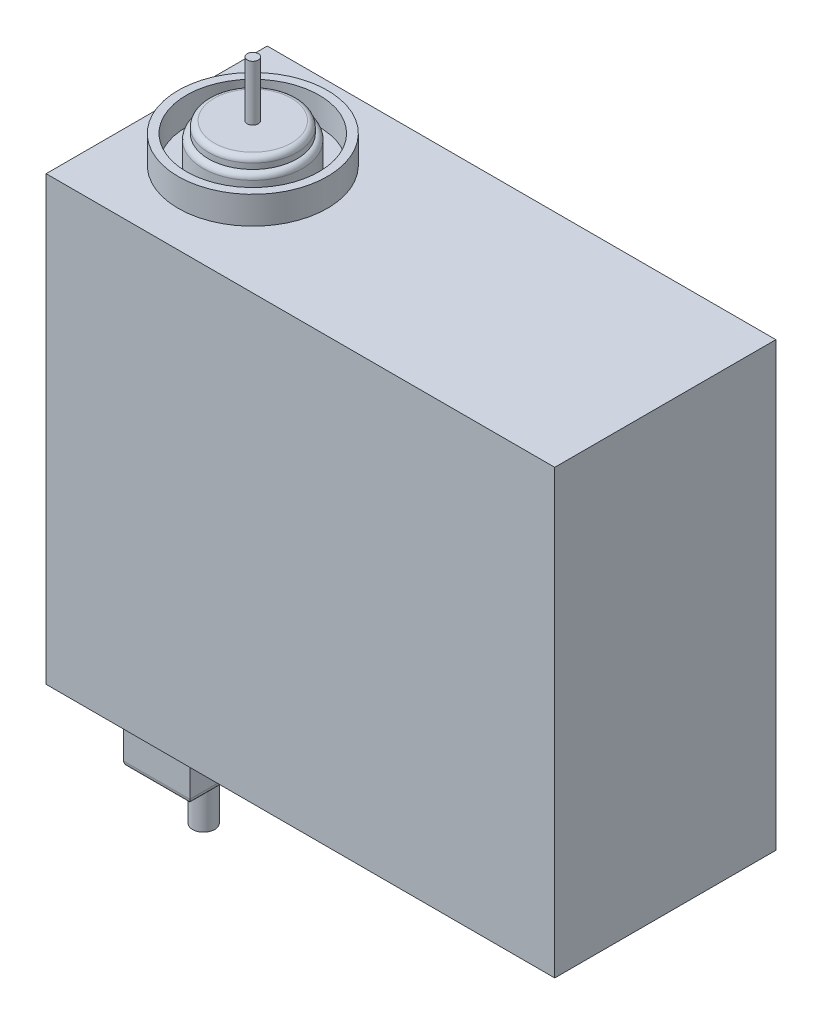
from build123d import *

# Parameters (mm, degrees)
SKETCH1_W           = 46
SKETCH1_H           = 20
BOSS_EXTRUDE1_DEPTH = 40
BOSS_EXTRUDE2_DEPTH = 2.5
SKETCH3_R           = 4
BOSS_EXTRUDE3_DEPTH = 1
FILLET3_R           = 0.5
FILLET4_R           = 0.5
SKETCH5_R           = 0.5
BOSS_EXTRUDE4_DEPTH = 5
SKETCH6_W           = 6
SKETCH6_H           = 16
BOSS_EXTRUDE5_DEPTH = 5
FILLET5_R           = 0.5
SKETCH7_R           = 1
BOSS_EXTRUDE6_DEPTH = 5


with BuildPart() as part:
    # Sketch1 → Boss-Extrude1 (new body)
    with BuildSketch(Plane(origin=(0, 0, 0), x_dir=(1, 0, 0), z_dir=(0, 1, 0))):
        with Locations((-31.181375009, 16.970817206)):
            Rectangle(SKETCH1_W, SKETCH1_H)
    extrude(amount=BOSS_EXTRUDE1_DEPTH)

    # Sketch2 → Boss-Extrude2 (add)
    with BuildSketch(Plane(origin=(0, 40, 0), x_dir=(1, 0, 0), z_dir=(0, 1, 0))):
        with BuildLine():
            ThreePointArc((-49.989558352, 16.970817206), (-45.489558352, 12.470817206), (-40.989558352, 16.970817206))
            Line((-40.989558352, 16.970817206), (-49.989558352, 16.970817206))
        make_face()
        with BuildLine():
            Line((-49.989558352, 16.970817206), (-40.989558352, 16.970817206))
            ThreePointArc((-40.989558352, 16.970817206), (-45.489558352, 21.470817206), (-49.989558352, 16.970817206))
        make_face()
        with BuildLine():
            ThreePointArc((-51.489558352, 16.970817206), (-45.489558352, 22.970817206), (-39.489558352, 16.970817206))
            Line((-39.489558352, 16.970817206), (-38.739558352, 16.970817206))
            ThreePointArc((-38.739558352, 16.970817206), (-45.489558352, 23.720817206), (-52.239558352, 16.970817206))
            Line((-52.239558352, 16.970817206), (-51.489558352, 16.970817206))
        make_face()
        with BuildLine():
            Line((-38.739558352, 16.970817206), (-39.489558352, 16.970817206))
            ThreePointArc((-39.489558352, 16.970817206), (-45.489558352, 10.970817206), (-51.489558352, 16.970817206))
            Line((-51.489558352, 16.970817206), (-52.239558352, 16.970817206))
            ThreePointArc((-52.239558352, 16.970817206), (-45.489558352, 10.220817206), (-38.739558352, 16.970817206))
        make_face()
    extrude(amount=BOSS_EXTRUDE2_DEPTH)

    # Sketch3 → Boss-Extrude3 (add)
    with BuildSketch(Plane(origin=(0, 42.5, 0), x_dir=(1, 0, 0), z_dir=(0, 1, 0))):
        with Locations(Location((-45.489558352, 16.970817206, 0), (0, 0, 270))):
            Circle(SKETCH3_R)
    extrude(amount=BOSS_EXTRUDE3_DEPTH)

    # Fillet3
    fillet3_edges = [part.edges().sort_by_distance(p)[0] for p in [
        (-45.489558352, 43.5, -20.970817206),
    ]]
    fillet(fillet3_edges, radius=FILLET3_R)

    # Fillet4
    fillet4_edges = [part.edges().sort_by_distance(p)[0] for p in [
        (-40.989558352, 42.5, -16.970817206),
    ]]
    fillet(fillet4_edges, radius=FILLET4_R - 0.0001)  # a hair under: the kernel refuses the full size

    # Sketch5 → Boss-Extrude4 (add)
    with BuildSketch(Plane(origin=(0, 43.5, 0), x_dir=(1, 0, 0), z_dir=(0, 1, 0))):
        with Locations(Location((-45.489558352, 16.970817206, 0), (0, 0, 270))):
            Circle(SKETCH5_R)
    extrude(amount=BOSS_EXTRUDE4_DEPTH)

    # Sketch6 → Boss-Extrude5 (add)
    with BuildSketch(Plane.XZ):
        with Locations((-46.181375009, -16.970817206)):
            Rectangle(SKETCH6_W, SKETCH6_H)
    extrude(amount=BOSS_EXTRUDE5_DEPTH)

    # Fillet5
    fillet5_edges = [part.edges().sort_by_distance(p)[0] for p in [
        (-49.181375009, -5, -16.970817206),
        (-46.181375009, -5, -24.970817206),
        (-43.181375009, -5, -16.970817206),
        (-46.181375009, -5, -8.970817206),
    ]]
    fillet(fillet5_edges, radius=FILLET5_R)

    # Sketch7 → Boss-Extrude6 (add)
    with BuildSketch(Plane(origin=(0, -5, 0), x_dir=(-1, 0, 0), z_dir=(0, -1, 0))):
        with Locations(Location((46.181375009, 13.220817206, 0), (0, 0, 90))):
            Circle(SKETCH7_R)
        with Locations(Location((46.181375009, 20.720817206, 0), (0, 0, 90))):
            Circle(SKETCH7_R)
    extrude(amount=BOSS_EXTRUDE6_DEPTH)


solid = part.part
